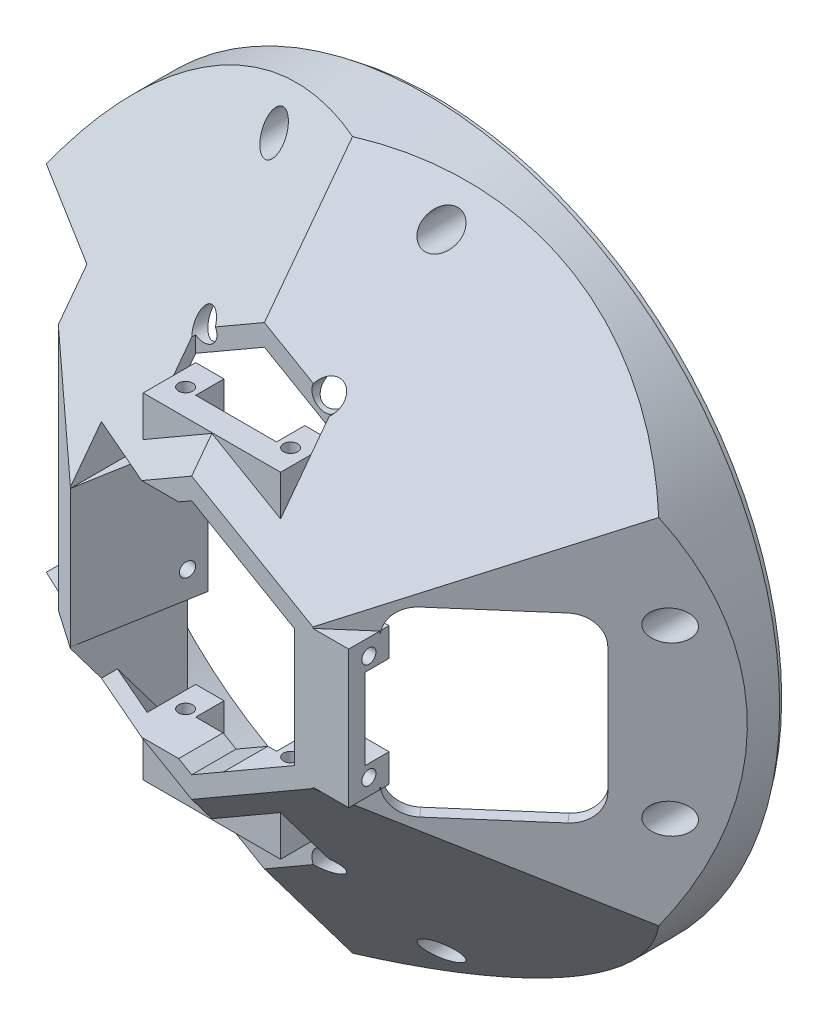
from build123d import *

# Parameters (mm, degrees)
SKETCH1_R                       = 87.5
BOSS_EXTRUDE1_DEPTH             = 60
CUT_EXTRUDE1_DEPTH              = 138.522725395
CIRPATTERN1_COUNT               = 6
SHELL1_T                        = -3
SKETCH3_R                       = 87.5
SKETCH3_R_2                     = 86
CUT_EXTRUDE2_DEPTH              = 2
CUT_EXTRUDE3_DEPTH              = 138.522725395
BOSS_EXTRUDE2_REACH             = 139.523
SKETCH6_R                       = 1.75
CUT_EXTRUDE4_DEPTH              = 138.522725395
SKETCH7_R                       = 3.75
CUT_EXTRUDE5_DEPTH              = 55
CIRPATTERN2_COPY_1_REACH        = 139.523
CIRPATTERN2_COPY_2_REACH        = 139.523
CIRPATTERN2_COPY_3_SKETCH_R     = 1.75
CIRPATTERN2_COPY_3_DEPTH        = 138.522725395
CIRPATTERN2_COPY_4_SKETCH_R     = 1.75
CIRPATTERN2_COPY_4_DEPTH        = 138.522725395
CIRPATTERN2_COPY_5_SKETCH_R     = 3.75
CIRPATTERN2_COPY_5_DEPTH        = 55
CIRPATTERN2_COPY_6_SKETCH_R     = 3.75
CIRPATTERN2_COPY_6_DEPTH        = 55
CIRPATTERN2_COPY_7_REACH        = 139.523
CIRPATTERN2_COPY_8_REACH        = 139.523
CIRPATTERN2_COPY_9_SKETCH_R     = 1.75
CIRPATTERN2_COPY_9_DEPTH        = 138.522725395
CIRPATTERN2_COPY_10_SKETCH_R    = 1.75
CIRPATTERN2_COPY_10_DEPTH       = 138.522725395
CIRPATTERN2_COPY_11_SKETCH_R    = 3.75
CIRPATTERN2_COPY_11_DEPTH       = 55
CIRPATTERN2_COPY_12_SKETCH_R    = 3.75
CIRPATTERN2_COPY_12_DEPTH       = 55
CUT_EXTRUDE6_DEPTH              = 156.173102014
SKETCH10_W                      = 34
SKETCH10_H                      = 13
CUT_EXTRUDE8_DEPTH              = 138.522725395
BOSS_EXTRUDE4_REACH             = 132.677
SKETCH13_R                      = 1.75
SKETCH13_W                      = 20
SKETCH13_H                      = 7
CUT_EXTRUDE9_DEPTH              = 8
BOSS_EXTRUDE5_START             = 10
SKETCH14_R                      = 1.75
BOSS_EXTRUDE5_DEPTH             = 10
SKETCH15_R                      = 3.25
CUT_EXTRUDE10_DEPTH             = 138.522725395
SKETCH16_W                      = 13.425377671
SKETCH16_H                      = 34
BOSS_EXTRUDE6_DEPTH             = 10
SKETCH17_R                      = 1.75
SKETCH17_W                      = 9.517072595
SKETCH17_H                      = 20
CUT_EXTRUDE11_DEPTH             = 37
SKETCH18_W                      = 26.775247601
SKETCH18_H                      = 55
CUT_EXTRUDE12_DEPTH             = 37
BOSS_EXTRUDE7_REACH             = 139.523
BOSS_EXTRUDE7_DIRECTION_2_REACH = 139.523
BOSS_EXTRUDE8_DEPTH             = 17
BOSS_EXTRUDE8_DEPTH_BACK        = 17
SKETCH21_R                      = 1.75
CUT_EXTRUDE13_DEPTH             = 25


with BuildPart() as part:
    # Sketch1 → Boss-Extrude1 (new body)
    with BuildSketch(Plane.XY):
        Circle(SKETCH1_R)
    extrude(amount=BOSS_EXTRUDE1_DEPTH)

    # Sketch2 → Cut-Extrude1 (cut, symmetric)
    with BuildSketch(Plane(origin=(0, 0, 0), x_dir=(1, 0, 0), z_dir=(0, 1, 0))):
        Polygon((-73.465543034, -109.985374489), (-130.965543034, -59.985374489), (-87.5, -10), (-30, -60), align=None)
    cut_extrude1 = extrude(amount=CUT_EXTRUDE1_DEPTH, both=True, mode=Mode.SUBTRACT)

    # CirPattern1: Cut-Extrude1 ×6 about axis
    cirpattern1_axis = Axis((0, 0, 0), (0, 0, 1))
    for i in range(1, CIRPATTERN1_COUNT):
        add(cut_extrude1.rotate(cirpattern1_axis, i * 360 / CIRPATTERN1_COUNT), mode=Mode.SUBTRACT)

    # Shell1
    shell1_openings = [part.faces().sort_by_distance(p)[0] for p in [
        (0, 0, 0),
        (0, 0, 60),
    ]]
    offset(amount=SHELL1_T, openings=shell1_openings)

    # Sketch3 → Cut-Extrude2 (cut)
    with BuildSketch(Plane(origin=(0, 0, 0), x_dir=(-1, 0, 0), z_dir=(0, 0, -1))):
        Circle(SKETCH3_R)
        Circle(SKETCH3_R_2, mode=Mode.SUBTRACT)
    extrude(amount=-CUT_EXTRUDE2_DEPTH, mode=Mode.SUBTRACT)

    # Sketch4 → Cut-Extrude3 (cut, through all)
    with BuildSketch(Plane.XY):
        with BuildLine():
            Line((-53, 40), (-53, -40))
            Line((-53, -40), (-75.777222831, -43.75))
            ThreePointArc((-75.777222831, -43.75), (-87.5, 0), (-75.777222831, 43.75))
            Line((-75.777222831, 43.75), (-53, 40))
        make_face()
    extrude(amount=CUT_EXTRUDE3_DEPTH, mode=Mode.SUBTRACT)

    # Sketch5 → Boss-Extrude2 (add, up to next)
    with BuildSketch(Plane.XY, mode=Mode.PRIVATE) as boss_extrude2_sk1:
        with BuildLine():
            Line((-23.508288122, 73.13347302), (-31.375780211, 78.458972821))
            ThreePointArc((-31.375780211, 78.458972821), (-21.870209311, 81.620732321), (-12.057263685, 83.635353723))
            Line((-12.057263685, 83.635353723), (-16.207961797, 75.089589564))
            ThreePointArc((-16.207961797, 75.089589564), (-19.411428383, 72.444436972), (-23.508288122, 73.13347302))
        make_face()
    boss_extrude2_tool1 = extrude(boss_extrude2_sk1.sketch, amount=BOSS_EXTRUDE2_REACH, mode=Mode.PRIVATE) - part.part
    boss_extrude2 = boss_extrude2_tool1.solids().sort_by_distance((-20.887689, 77.953916, 0))[0]
    add(boss_extrude2)

    # Sketch6 → Cut-Extrude4 (cut, through all)
    with BuildSketch(Plane(origin=(0, 0, 0), x_dir=(-1, 0, 0), z_dir=(0, 0, -1))):
        with Locations((20.705523608, 77.274066103)):
            Circle(SKETCH6_R)
    cut_extrude4 = extrude(amount=-CUT_EXTRUDE4_DEPTH, mode=Mode.SUBTRACT)

    # Sketch7 → Cut-Extrude5 (cut)
    with BuildSketch(Plane.XY.offset(60)):
        with Locations((-20.705523608, 77.274066103)):
            Circle(SKETCH7_R)
    cut_extrude5 = extrude(amount=-CUT_EXTRUDE5_DEPTH, mode=Mode.SUBTRACT)

    # Mirror1: Boss-Extrude2, Cut-Extrude4, Cut-Extrude5 across plane
    add(boss_extrude2.mirror(Plane(origin=(0, 0, 0), x_dir=(0, 0, 1), z_dir=(1, 0, 0))))
    add(cut_extrude4.mirror(Plane(origin=(0, 0, 0), x_dir=(0, 0, 1), z_dir=(1, 0, 0))), mode=Mode.SUBTRACT)
    add(cut_extrude5.mirror(Plane(origin=(0, 0, 0), x_dir=(0, 0, 1), z_dir=(1, 0, 0))), mode=Mode.SUBTRACT)

    # CirPattern2 copy 1 sketch → CirPattern2 copy 1 (add, up to next)
    with BuildSketch(Plane(origin=(0, 0, 0), x_dir=(0, 1, 0), z_dir=(0, 0, 1)), mode=Mode.PRIVATE) as cirpattern2_copy_1_sk1:
        with BuildLine():
            Line((-23.508288122, -73.13347302), (-31.375780211, -78.458972821))
            ThreePointArc((-31.375780211, -78.458972821), (-21.870209311, -81.620732321), (-12.057263685, -83.635353723))
            Line((-12.057263685, -83.635353723), (-16.207961797, -75.089589564))
            ThreePointArc((-16.207961797, -75.089589564), (-19.411428383, -72.444436972), (-23.508288122, -73.13347302))
        make_face()
    cirpattern2_copy_1_tool1 = extrude(cirpattern2_copy_1_sk1.sketch, amount=CIRPATTERN2_COPY_1_REACH, mode=Mode.PRIVATE) - part.part
    add(cirpattern2_copy_1_tool1.solids().sort_by_distance((77.953916, -20.887689, 0))[0])

    # CirPattern2 copy 2 sketch → CirPattern2 copy 2 (add, up to next)
    with BuildSketch(Plane.XY, mode=Mode.PRIVATE) as cirpattern2_copy_2_sk1:
        with BuildLine():
            Line((-23.508288122, -73.13347302), (-31.375780211, -78.458972821))
            ThreePointArc((-31.375780211, -78.458972821), (-21.870209311, -81.620732321), (-12.057263685, -83.635353723))
            Line((-12.057263685, -83.635353723), (-16.207961797, -75.089589564))
            ThreePointArc((-16.207961797, -75.089589564), (-19.411428383, -72.444436972), (-23.508288122, -73.13347302))
        make_face()
    cirpattern2_copy_2_tool1 = extrude(cirpattern2_copy_2_sk1.sketch, amount=CIRPATTERN2_COPY_2_REACH, mode=Mode.PRIVATE) - part.part
    add(cirpattern2_copy_2_tool1.solids().sort_by_distance((-20.887689, -77.953916, 0))[0])

    # CirPattern2 copy 3 sketch → CirPattern2 copy 3 (cut, through all)
    with BuildSketch(Plane(origin=(0, 0, 0), x_dir=(0, -1, 0), z_dir=(0, 0, -1))):
        with Locations((20.705523608, -77.274066103)):
            Circle(CIRPATTERN2_COPY_3_SKETCH_R)
    extrude(amount=-CIRPATTERN2_COPY_3_DEPTH, mode=Mode.SUBTRACT)

    # CirPattern2 copy 4 sketch → CirPattern2 copy 4 (cut, through all)
    with BuildSketch(Plane(origin=(0, 0, 0), x_dir=(-1, 0, 0), z_dir=(0, 0, -1))):
        with Locations((20.705523608, -77.274066103)):
            Circle(CIRPATTERN2_COPY_4_SKETCH_R)
    extrude(amount=-CIRPATTERN2_COPY_4_DEPTH, mode=Mode.SUBTRACT)

    # CirPattern2 copy 5 sketch → CirPattern2 copy 5 (cut)
    with BuildSketch(Plane(origin=(0, 0, 60), x_dir=(0, 1, 0), z_dir=(0, 0, 1))):
        with Locations((-20.705523608, -77.274066103)):
            Circle(CIRPATTERN2_COPY_5_SKETCH_R)
    extrude(amount=-CIRPATTERN2_COPY_5_DEPTH, mode=Mode.SUBTRACT)

    # CirPattern2 copy 6 sketch → CirPattern2 copy 6 (cut)
    with BuildSketch(Plane.XY.offset(60)):
        with Locations((-20.705523608, -77.274066103)):
            Circle(CIRPATTERN2_COPY_6_SKETCH_R)
    extrude(amount=-CIRPATTERN2_COPY_6_DEPTH, mode=Mode.SUBTRACT)

    # CirPattern2 copy 7 sketch → CirPattern2 copy 7 (add, up to next)
    with BuildSketch(Plane(origin=(0, 0, 0), x_dir=(0, -1, 0), z_dir=(0, 0, 1)), mode=Mode.PRIVATE) as cirpattern2_copy_7_sk1:
        with BuildLine():
            Line((-23.508288122, 73.13347302), (-31.375780211, 78.458972821))
            ThreePointArc((-31.375780211, 78.458972821), (-21.870209311, 81.620732321), (-12.057263685, 83.635353723))
            Line((-12.057263685, 83.635353723), (-16.207961797, 75.089589564))
            ThreePointArc((-16.207961797, 75.089589564), (-19.411428383, 72.444436972), (-23.508288122, 73.13347302))
        make_face()
    cirpattern2_copy_7_tool1 = extrude(cirpattern2_copy_7_sk1.sketch, amount=CIRPATTERN2_COPY_7_REACH, mode=Mode.PRIVATE) - part.part
    add(cirpattern2_copy_7_tool1.solids().sort_by_distance((77.953916, 20.887689, 0))[0])

    # CirPattern2 copy 8 sketch → CirPattern2 copy 8 (add, up to next)
    with BuildSketch(Plane(origin=(0, 0, 0), x_dir=(-1, 0, 0), z_dir=(0, 0, 1)), mode=Mode.PRIVATE) as cirpattern2_copy_8_sk1:
        with BuildLine():
            Line((-23.508288122, 73.13347302), (-31.375780211, 78.458972821))
            ThreePointArc((-31.375780211, 78.458972821), (-21.870209311, 81.620732321), (-12.057263685, 83.635353723))
            Line((-12.057263685, 83.635353723), (-16.207961797, 75.089589564))
            ThreePointArc((-16.207961797, 75.089589564), (-19.411428383, 72.444436972), (-23.508288122, 73.13347302))
        make_face()
    cirpattern2_copy_8_tool1 = extrude(cirpattern2_copy_8_sk1.sketch, amount=CIRPATTERN2_COPY_8_REACH, mode=Mode.PRIVATE) - part.part
    add(cirpattern2_copy_8_tool1.solids().sort_by_distance((20.887689, -77.953916, 0))[0])

    # CirPattern2 copy 9 sketch → CirPattern2 copy 9 (cut, through all)
    with BuildSketch(Plane.YX):
        with Locations((20.705523608, 77.274066103)):
            Circle(CIRPATTERN2_COPY_9_SKETCH_R)
    extrude(amount=-CIRPATTERN2_COPY_9_DEPTH, mode=Mode.SUBTRACT)

    # CirPattern2 copy 10 sketch → CirPattern2 copy 10 (cut, through all)
    with BuildSketch(Plane(origin=(0, 0, 0), x_dir=(1, 0, 0), z_dir=(0, 0, -1))):
        with Locations((20.705523608, 77.274066103)):
            Circle(CIRPATTERN2_COPY_10_SKETCH_R)
    extrude(amount=-CIRPATTERN2_COPY_10_DEPTH, mode=Mode.SUBTRACT)

    # CirPattern2 copy 11 sketch → CirPattern2 copy 11 (cut)
    with BuildSketch(Plane(origin=(0, 0, 60), x_dir=(0, -1, 0), z_dir=(0, 0, 1))):
        with Locations((-20.705523608, 77.274066103)):
            Circle(CIRPATTERN2_COPY_11_SKETCH_R)
    extrude(amount=-CIRPATTERN2_COPY_11_DEPTH, mode=Mode.SUBTRACT)

    # CirPattern2 copy 12 sketch → CirPattern2 copy 12 (cut)
    with BuildSketch(Plane(origin=(0, 0, 60), x_dir=(-1, 0, 0), z_dir=(0, 0, 1))):
        with Locations((-20.705523608, 77.274066103)):
            Circle(CIRPATTERN2_COPY_12_SKETCH_R)
    extrude(amount=-CIRPATTERN2_COPY_12_DEPTH, mode=Mode.SUBTRACT)

    # Sketch8 → Cut-Extrude6 (cut, through all)
    with BuildSketch(Plane(origin=(42.626480086, 0, 49.020452099), x_dir=(0.7546055221635047, 0, -0.6561787149247867), z_dir=(0.6561787149247867, 0, 0.7546055221635047))):
        with BuildLine():
            Line((2, 22.5), (28, 22.5))
            ThreePointArc((28, 22.5), (32.949747468, 20.449747468), (35, 15.5))
            Line((35, 15.5), (35, -15.5))
            ThreePointArc((35, -15.5), (32.949747468, -20.449747468), (28, -22.5))
            Line((28, -22.5), (2, -22.5))
            ThreePointArc((2, -22.5), (-2.949747468, -20.449747468), (-5, -15.5))
            Line((-5, -15.5), (-5, 15.5))
            ThreePointArc((-5, 15.5), (-2.949747468, 20.449747468), (2, 22.5))
        make_face()
    extrude(amount=-CUT_EXTRUDE6_DEPTH, mode=Mode.SUBTRACT)

    # Sketch10 → Cut-Extrude8 (cut, through all)
    with BuildSketch(Plane(origin=(0, 0, 0), x_dir=(1, 0, 0), z_dir=(0, 1, 0))):
        with Locations((0, -48.5)):
            Rectangle(SKETCH10_W, SKETCH10_H)
    cut_extrude8 = extrude(amount=-CUT_EXTRUDE8_DEPTH, mode=Mode.SUBTRACT)

    # Sketch12 → Boss-Extrude4 (add, up to next)
    with BuildSketch(Plane.XY.offset(42), mode=Mode.PRIVATE) as boss_extrude4_sk1:
        Polygon((-17, -31.465589671), (17, -31.465589671), (17, -24.826061575), (7.856149608, -24.826061575), (0, -29.361811666), (-7.856149608, -24.826061575), (-17, -24.826061575), align=None)
    boss_extrude4_tool1 = extrude(boss_extrude4_sk1.sketch, amount=BOSS_EXTRUDE4_REACH, mode=Mode.PRIVATE) - part.part
    boss_extrude4 = boss_extrude4_tool1.solids().sort_by_distance((0, -31.119167, 42))[0]
    add(boss_extrude4)

    # Sketch13 → Cut-Extrude9 (cut)
    with BuildSketch(Plane.XZ.offset(31.465589671)):
        with Locations((-13, 48.5)):
            Circle(SKETCH13_R)
        with Locations((13, 48.5)):
            Circle(SKETCH13_R)
        with Locations((0, 45.5)):
            Rectangle(SKETCH13_W, SKETCH13_H)
    cut_extrude9 = extrude(amount=-CUT_EXTRUDE9_DEPTH, mode=Mode.SUBTRACT)

    # Sketch14 → Boss-Extrude5 (add)
    with BuildSketch(Plane.XZ.offset(31.465589671).offset(BOSS_EXTRUDE5_START)):
        Polygon((-17, 42), (-10, 42), (-10, 49), (10, 49), (10, 42), (17, 42), (17, 51.024412873), (17, 55), (-7.856149608, 55), (-17, 55), (-17, 51.024412873), align=None)
        with Locations((13, 48.5)):
            Circle(SKETCH14_R, mode=Mode.SUBTRACT)
        with Locations((-13, 48.5)):
            Circle(SKETCH14_R, mode=Mode.SUBTRACT)
    boss_extrude5 = extrude(amount=-BOSS_EXTRUDE5_DEPTH)

    # Mirror2: Cut-Extrude8, Boss-Extrude4, Cut-Extrude9, Boss-Extrude5 across plane
    add(cut_extrude8.mirror(Plane.ZX), mode=Mode.SUBTRACT)
    add(boss_extrude4.mirror(Plane.ZX))
    add(cut_extrude9.mirror(Plane.ZX), mode=Mode.SUBTRACT)
    add(boss_extrude5.mirror(Plane.ZX))

    # Sketch15 → Cut-Extrude10 (cut, through all)
    with BuildSketch(Plane.XY):
        with Locations((-15, 50)):
            Circle(SKETCH15_R)
        with Locations((15, 50)):
            Circle(SKETCH15_R)
        with Locations((15, -50)):
            Circle(SKETCH15_R)
        with Locations((-15, -50)):
            Circle(SKETCH15_R)
    extrude(amount=CUT_EXTRUDE10_DEPTH, mode=Mode.SUBTRACT)

    # Sketch16 → Boss-Extrude6 (add)
    with BuildSketch(Plane.XY.offset(60)):
        with Locations((32.14076364, 0)):
            Rectangle(SKETCH16_W, SKETCH16_H)
    extrude(amount=-BOSS_EXTRUDE6_DEPTH)

    # Sketch17 → Cut-Extrude11 (cut)
    with BuildSketch(Plane(origin=(38.853452475, 0, 0), x_dir=(0, 0, -1), z_dir=(1, 0, 0))):
        with Locations((-55, 13)):
            Circle(SKETCH17_R)
        with Locations((-55, -13)):
            Circle(SKETCH17_R)
        with Locations((-51.241463702, 0)):
            Rectangle(SKETCH17_W, SKETCH17_H)
    extrude(amount=-CUT_EXTRUDE11_DEPTH, mode=Mode.SUBTRACT)

    # Sketch18 → Cut-Extrude12 (cut)
    with BuildSketch(Plane.XY.offset(60)):
        with Locations((-16.6123762, 0)):
            Rectangle(SKETCH18_W, SKETCH18_H)
    extrude(amount=-CUT_EXTRUDE12_DEPTH, mode=Mode.SUBTRACT)

    # Sketch19 → Boss-Extrude7 (add, up to next)
    with BuildSketch(Plane(origin=(0, 0, 0), x_dir=(1, 0, 0), z_dir=(0, 1, 0)), mode=Mode.PRIVATE) as boss_extrude7_sk1:
        Polygon((-30, -56.024412873), (-30, -31.024412873), (-35, -31.024412873), (-35, -51.676586786), align=None)
    boss_extrude7_tool1 = extrude(boss_extrude7_sk1.sketch, amount=BOSS_EXTRUDE7_REACH, mode=Mode.PRIVATE) - part.part
    add(boss_extrude7_tool1.solids().sort_by_distance((-32.420635, 0, 42.471963))[0])

    # Sketch19 → Boss-Extrude7 direction 2 (add, up to next)
    with BuildSketch(Plane(origin=(0, 0, 0), x_dir=(1, 0, 0), z_dir=(0, 1, 0)), mode=Mode.PRIVATE) as boss_extrude7_direction_2_sk1:
        Polygon((-30, -56.024412873), (-30, -31.024412873), (-35, -31.024412873), (-35, -51.676586786), align=None)
    boss_extrude7_direction_2_tool1 = extrude(boss_extrude7_direction_2_sk1.sketch, amount=-BOSS_EXTRUDE7_DIRECTION_2_REACH, mode=Mode.PRIVATE) - part.part
    add(boss_extrude7_direction_2_tool1.solids().sort_by_distance((-32.420635, 0, 42.471963))[0])

    # Sketch20 → Boss-Extrude8 (add, two sides: drawn at the far end of the back side and taken through both)
    with BuildSketch(Plane(origin=(0, 0, 0), x_dir=(1, 0, 0), z_dir=(0, 1, 0)).offset(-BOSS_EXTRUDE8_DEPTH_BACK)):
        Polygon((-30, -31.024412873), (-24.890822208, -31.024412873), (-30, -60), align=None)
    extrude(amount=BOSS_EXTRUDE8_DEPTH + BOSS_EXTRUDE8_DEPTH_BACK)

    # Sketch21 → Cut-Extrude13 (cut)
    with BuildSketch(Plane(origin=(-18.834785012, 0, -3.321080773), x_dir=(0.17364817766692345, 0, -0.9848077530122092), z_dir=(0.9848077530122092, 0, 0.17364817766692345))):
        with Locations((-39.297910511, 10.5)):
            Circle(SKETCH21_R)
        with Locations((-39.297910511, -10.5)):
            Circle(SKETCH21_R)
    extrude(amount=-CUT_EXTRUDE13_DEPTH, mode=Mode.SUBTRACT)


solid = part.part
